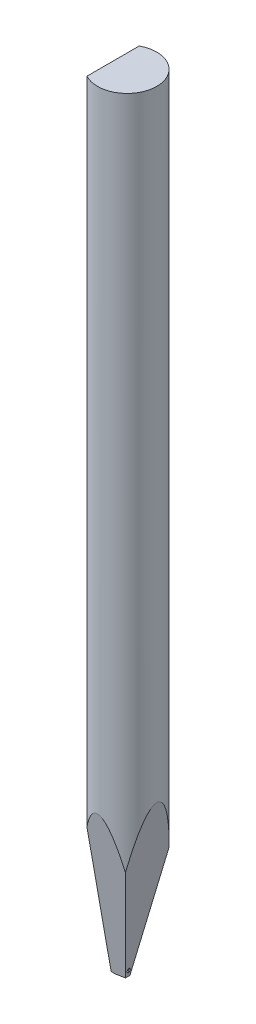
from build123d import *

# Parameters (mm, degrees)
TD_SKETCH_R                             = 0.79248
TL_FEATURE_DEPTH                        = 21.0312
TDF_STD_SKETCH_W                        = 2.09296
TDF_STD_SKETCH_H                        = 2.09296
TDF_STD_FEATURE_DEPTH                   = 22.061040395
ISA_20_STD_FEATURE_DEPTH                = 22.061040395
ISA_20_STD_FEATURE_DEPTH_BACK           = 22.061040395
F_10BA_STD_FEATURE_DEPTH                = 22.061040395
F_10BA_STD_FEATURE_DEPTH_BACK           = 22.061040395
FRO_STD_FEATURE_DEPTH                   = 22.061040395
FRO_STD_FEATURE_DEPTH_BACK              = 22.061040395
VG_STD_FEATURE_DEPTH                    = 22.061040395
VG_STD_FEATURE_DEPTH_BACK               = 22.061040395
ERW_STD_FEATURE_DEPTH                   = 0.0254
H_STD_FEATURE_REACH                     = 22.889
H_STD_SKETCH_R                          = 0.0254
H_STD_SKETCH_3_R                        = 0.0254
FUNNEL_FINAL_DIAMETRE_STD_FEATURE_DEPTH = 2.499995
FUNNEL_FINAL_DIAMETRE_STD_FEATURE_DRAFT = -22.5
ROUND_BR_STD_FEATURE_START              = -1
ROUND_BR_STD_FEATURE_DEPTH              = 1.033123165


with BuildPart() as part:
    # TD_sketch → TL_feature (new body)
    with BuildSketch(Plane(origin=(0, 0, 0), x_dir=(1, 0, 0), z_dir=(0, 1, 0))):
        with Locations(Location((0, 0, 0), (0, 0, 270))):
            Circle(TD_SKETCH_R)
    extrude(amount=TL_FEATURE_DEPTH)

    # TDF_STD_sketch → TDF_STD_feature (cut, through all)
    with BuildSketch(Plane(origin=(0, 0, 0), x_dir=(1, 0, 0), z_dir=(0, 1, 0))):
        with Locations((-1.4224, 0)):
            Rectangle(TDF_STD_SKETCH_W, TDF_STD_SKETCH_H)
    extrude(amount=TDF_STD_FEATURE_DEPTH, mode=Mode.SUBTRACT)

    # ISA_20_STD_sketch → ISA_20_STD_feature (cut, two sides: drawn at the far end of the back side and taken through both)
    with BuildSketch(Plane(origin=(0, 0, 0), x_dir=(0, 0, -1), z_dir=(1, 0, 0)).offset(-ISA_20_STD_FEATURE_DEPTH_BACK)):
        Polygon((-12.968809457, 73.261672178), (-3.759167997, 21.0312), (-0.0508, 0), (0.0508, 0), (3.759167997, 21.0312), (12.968809457, 73.261672178), (12.968809457, -32.810750623), (-12.968809457, -32.810750623), align=None)
    extrude(amount=ISA_20_STD_FEATURE_DEPTH + ISA_20_STD_FEATURE_DEPTH_BACK, mode=Mode.SUBTRACT)

    # 10BA_STD_sketch → 10BA_STD_feature (cut, two sides: drawn at the far end of the back side and taken through both)
    with BuildSketch(Plane.XY.offset(-F_10BA_STD_FEATURE_DEPTH_BACK)):
        Polygon((-53.226091717, 0), (-0.37592, 0), (-0.277370032, 0), (0.014143507, 0.051401702), (3.713447997, 21.0312), (12.890784005, 73.078458855), (91.272293615, 2.163710365), (25.155417893, -70.914748491), align=None)
    extrude(amount=F_10BA_STD_FEATURE_DEPTH + F_10BA_STD_FEATURE_DEPTH_BACK, mode=Mode.SUBTRACT)

    # FRO_STD_sketch → FRO_STD_feature (cut, two sides: drawn at the far end of the back side and taken through both)
    with BuildSketch(Plane.XY.offset(-FRO_STD_FEATURE_DEPTH_BACK)):
        with BuildLine():
            Line((-0.37592, 52.149873762), (-0.37592, 0.0254))
            ThreePointArc((-0.37592, 0.0254), (-0.368480512, 0.007439488), (-0.35052, 0))
            Line((-0.35052, 0), (51.773953762, 0))
            Line((51.773953762, 0), (-21.941183964, -73.715137726))
            Line((-21.941183964, -73.715137726), (-74.091057726, -21.565263964))
            Line((-74.091057726, -21.565263964), (-0.37592, 52.149873762))
        make_face()
    extrude(amount=FRO_STD_FEATURE_DEPTH + FRO_STD_FEATURE_DEPTH_BACK, mode=Mode.SUBTRACT)

    # VG_STD_sketch → VG_STD_feature (cut, two sides: drawn at the far end of the back side and taken through both)
    with BuildSketch(Plane(origin=(0, 0, 0), x_dir=(0, 0, -1), z_dir=(1, 0, 0)).offset(-VG_STD_FEATURE_DEPTH_BACK)):
        with BuildLine():
            Line((-0.0127, 0), (-0.006906065, 0.012425133))
            ThreePointArc((-0.006906065, 0.012425133), (0, 0.016824782), (0.006906065, 0.012425133))
            Line((0.006906065, 0.012425133), (0.0127, 0))
            Line((0.0127, 0), (-0.0127, 0))
        make_face()
    extrude(amount=VG_STD_FEATURE_DEPTH + VG_STD_FEATURE_DEPTH_BACK, mode=Mode.SUBTRACT)


with BuildPart() as body_2:
    # ERW_STD_sketch → ERW_STD_feature (new, symmetric)
    with BuildSketch(Plane.XY):
        Polygon((-0.109730032, 0.1016), (-0.109730032, 0), (-0.300230032, 0), (-0.241571245, 0.1016), align=None)
    extrude(amount=ERW_STD_FEATURE_DEPTH, both=True)

    # H_STD_sketch → H_STD_feature (add, up to next)
    with BuildSketch(Plane(origin=(0.011364425, 0.171513918, 0), x_dir=(0, 0, -1), z_dir=(0.8660254037844415, 0.4999999999999953, 0)), mode=Mode.PRIVATE) as h_std_feature_sk1:
        with Locations(Location((0, 0, 0), (0, 0, 90))):
            Circle(H_STD_SKETCH_R)
    h_std_feature_tool1 = extrude(h_std_feature_sk1.sketch, amount=-H_STD_FEATURE_REACH, mode=Mode.PRIVATE) - body_2.part
    add(h_std_feature_tool1.solids().sort_by_distance((0.011364, 0.171514, 0))[0])


with BuildPart() as funnel_final_diametre_std_feature_tool:
    # H_STD_sketch<3> → funnel_final_diametre_STD_feature (with draft: the straight prism first)
    with BuildSketch(Plane(origin=(0.011364425, 0.171513918, 0), x_dir=(0, 0, -1), z_dir=(0.8660254037844415, 0.4999999999999953, 0))):
        with Locations(Location((0, 0, 0), (0, 0, 90))):
            Circle(H_STD_SKETCH_3_R)
    extrude(amount=FUNNEL_FINAL_DIAMETRE_STD_FEATURE_DEPTH)
    # funnel_final_diametre_STD_feature: the draft: its side faces are tilted about the plane it starts from
    funnel_final_diametre_std_feature_sides = [funnel_final_diametre_std_feature_tool.faces().sort_by_distance(p)[0] for p in [
        (1.106594015, 0.774515622, 0),
    ]]
    draft(funnel_final_diametre_std_feature_sides, Plane(origin=(0.011364425, 0.171513918, 0), x_dir=(0, 0, -1), z_dir=(0.8660254037844415, 0.4999999999999953, 0)), FUNNEL_FINAL_DIAMETRE_STD_FEATURE_DRAFT)


with BuildPart() as body_2_1:
    add(body_2.part)

    # funnel_final_diametre_STD_feature: add funnel_final_diametre_std_feature_tool
    add(funnel_final_diametre_std_feature_tool.part)

    # ROUND_BR_STD_feature: read off the stored shape, not the designer's step
    # ROUND_BR_STD_feature outline → ROUND_BR_STD_feature (cut)
    with BuildSketch(Plane(origin=(0, 0, 0), x_dir=(0.8660254037844362, -0.5000000000000042, 0), z_dir=(0.5000000000000042, 0.8660254037844363, 0)).offset(ROUND_BR_STD_FEATURE_START)):
        with BuildLine():
            Line((-0.260006835, -0.0254), (-0.234606835, -0.0254))
            ThreePointArc((-0.234606835, -0.0254), (-0.252567347, -0.017960512), (-0.260006835, 0))
            Line((-0.260006835, 0), (-0.260006835, -0.0254))
        make_face()
        with BuildLine():
            Line((-0.260006835, 0.0254), (-0.260006835, 0))
            ThreePointArc((-0.260006835, 0), (-0.252567347, 0.017960512), (-0.234606835, 0.0254))
            Line((-0.234606835, 0.0254), (-0.260006835, 0.0254))
        make_face()
    extrude(amount=ROUND_BR_STD_FEATURE_DEPTH, mode=Mode.SUBTRACT)


with BuildPart() as part_1:
    add(part.part)

    # COMBINE_STD_feature: cut body 2
    add(body_2_1.part, mode=Mode.SUBTRACT)


solid = part_1.part
